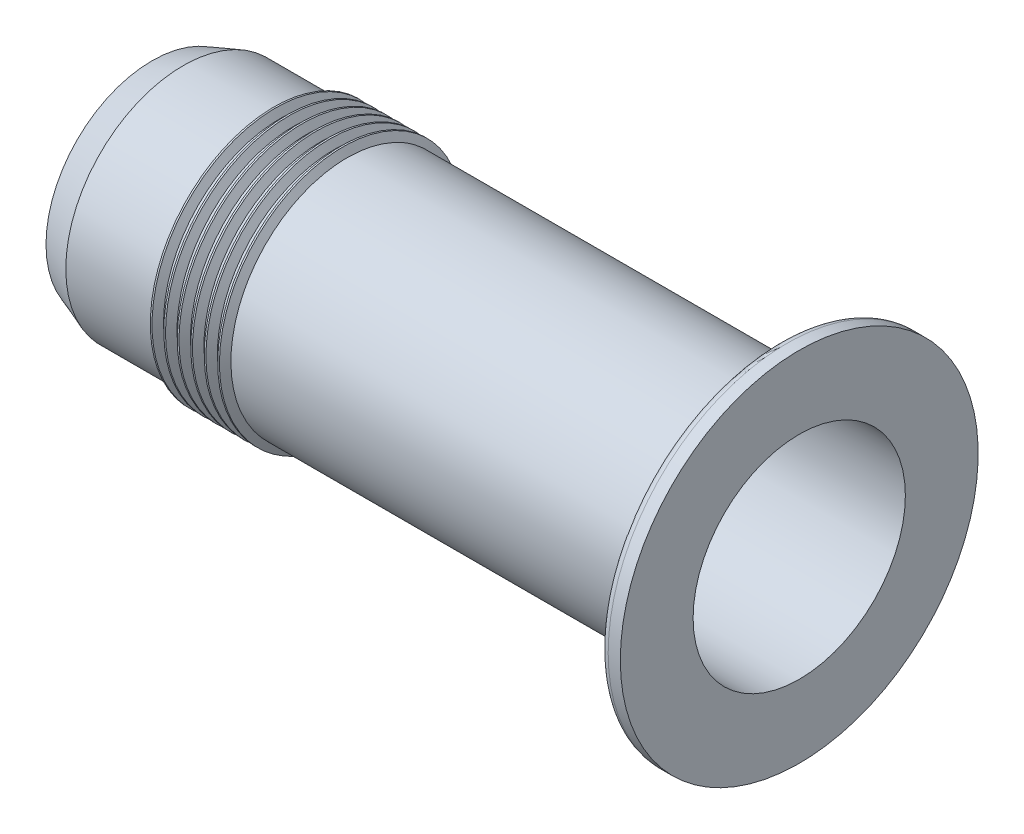
from build123d import *

# Parameters (mm, degrees)
THREAD2_PITCH = 2.116666667
FILLET1_R     = 1.27


with BuildPart() as part:
    # Sketch1 → Revolve1 (revolve)
    with BuildSketch(Plane.XY, mode=Mode.PRIVATE) as revolve1_sk:
        Polygon((0, 16.6624), (101.6, 16.6624), (101.6, 18.4404), (101.6, 28.0924), (98.425, 28.0924), (98.425, 18.4404), (19.05, 18.4404), (4.885014852, 18.4404), align=None)
    revolve(revolve1_sk.sketch.rotate(Axis((0, 0, 0), (1, 0, 0)), 90), axis=Axis((0, 0, 0), (1, 0, 0)))

    # Thread2: the profile of Thread Profile4 profile screwed along a right-hand helix of 6 turns, 10 arcs to a turn; built about Z, then put on its axis
    thread2_z = Axis((0, 0, 0), (0, 0, 1))
    thread2_corners = [(18.4401, 0, -0.000173205), (19.586079435, 0, 0.66145833), (19.586079435, 0, 0.926041664), (18.4401, 0, 1.587673199)]
    with BuildLine(mode=Mode.PRIVATE) as thread2_profile:
        Line(thread2_corners[0], thread2_corners[1])
        Line(thread2_corners[1], thread2_corners[2])
        Line(thread2_corners[2], thread2_corners[3])
        Line(thread2_corners[3], thread2_corners[0])
    thread2_cap = Face(thread2_profile.wire())
    thread2_turn_angles = [0, 18, 36, 54, 72, 90, 108, 126, 144, 162, 180, 198, 216, 234, 252, 270, 288, 306, 324, 342, 360]
    thread2_turn_weights = [1, 0.9510565162951535, 1, 0.9510565162951535, 1, 0.9510565162951535, 1, 0.9510565162951535, 1, 0.9510565162951535, 1, 0.9510565162951535, 1, 0.9510565162951535, 1, 0.9510565162951535, 1, 0.9510565162951535, 1, 0.9510565162951535, 1]
    thread2_turn_rails = [Edge.make_bspline([Vector(p[0], p[1], 0).rotate(thread2_z, thread2_turn_angles[k]) / thread2_turn_weights[k] + Vector(0, 0, p[2] + THREAD2_PITCH * thread2_turn_angles[k] / 360) for k in range(21)], [0, 0, 0, 1, 1, 2, 2, 3, 3, 4, 4, 5, 5, 6, 6, 7, 7, 8, 8, 9, 9, 10, 10, 10], 2, thread2_turn_weights) for p in thread2_corners]
    thread2_turn_sides = [Face.make_surface_from_curves(thread2_turn_rails[p[0]], thread2_turn_rails[p[1]]) for p in [(0, 1), (1, 2), (2, 3), (3, 0)]]
    thread2 = Plane(origin=(17.585014852, 0, 0), x_dir=(0, 0, -1), z_dir=(1, 0, 0)) * Solid(Shell([*[p.moved(Location((0, 0, THREAD2_PITCH * i))) for i in range(6) for p in thread2_turn_sides], thread2_cap, thread2_cap.rotate(thread2_z, 2160).moved(Location((0, 0, THREAD2_PITCH * 2160 / 360)))]))
    add(thread2)

    # Fillet1
    fillet1_edges = [part.edges().sort_by_distance(p)[0] for p in [
        (98.425, 0, -28.0924),
    ]]
    fillet(fillet1_edges, radius=FILLET1_R)


solid = part.part
